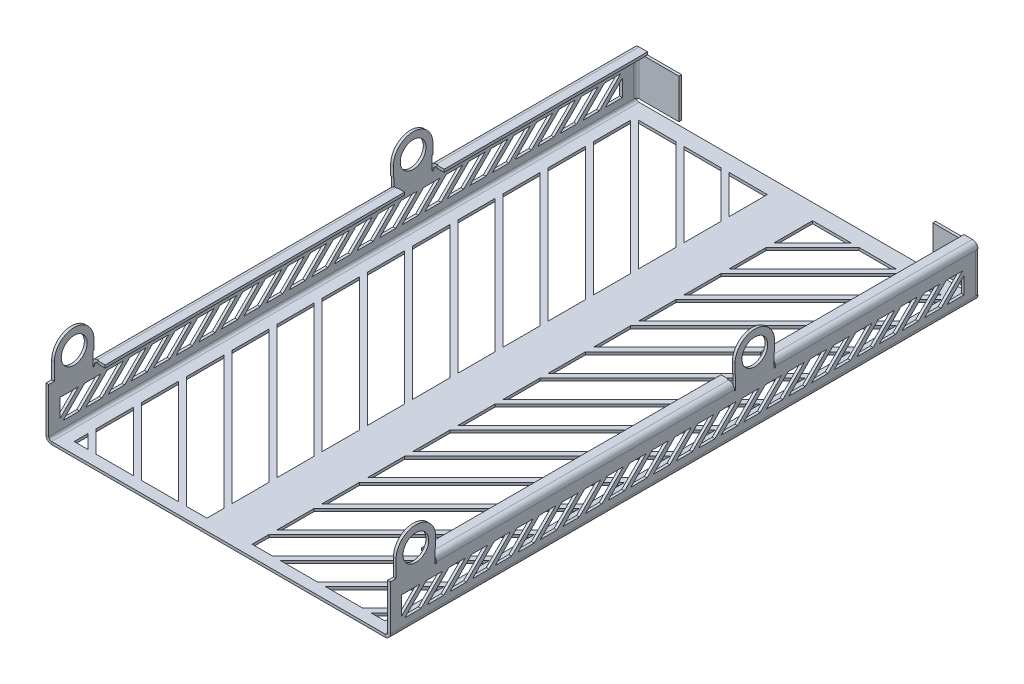
from build123d import *

# Parameters (mm, degrees)
EXTRUDE_THIN1_DEPTH          = 330.2
BOSS_EXTRUDE1_DEPTH          = 3.175
LPATTERN3_COUNT              = 2
LPATTERN3_PITCH              = 381
MIRROR5_COPY_1_DEPTH         = 3.175
CUT_EXTRUDE3_START           = -3.048
SKETCH28_W                   = 380.746
SKETCH28_H                   = 50.8
SKETCH28_H_2                 = 44.45
CUT_EXTRUDE3_DEPTH           = 3.048
F_1_1_8_CLEARANCE_HOLE1_D    = 28.97124
CONVERT_SOLID4_START         = -56.388
CONVERT_SOLID4_DEPTH         = 335.026
CONVERT_SOLID4_START_2       = -330.2
CONVERT_SOLID4_2_DEPTH       = 227.838
CONVERT_SOLID4_START_3       = -102.362
CONVERT_SOLID4_3_DEPTH       = 432.562
CONVERT_SOLID4_4_DEPTH       = 660.4
CONVERT_SOLID4_START_4       = -57.912
CONVERT_SOLID4_5_DEPTH       = 338.074
CONVERT_SOLID4_6_DEPTH       = 229.362
CONVERT_SOLID4_7_DEPTH       = 1.524
CONVERT_SOLID4_8_DEPTH       = 1.524
CONVERT_SOLID4_START_5       = 278.638
CONVERT_SOLID4_9_DEPTH       = 1.524
CONVERT_SOLID4_START_6       = 280.162
CONVERT_SOLID4_10_DEPTH      = 50.038
CONVERT_SOLID4_START_7       = -100.838
CONVERT_SOLID4_11_DEPTH      = 42.926
CONVERT_SOLID4_START_8       = -190.5
CONVERT_SOLID4_12_OUTLINE_R  = 14.48562
CONVERT_SOLID4_12_DEPTH      = 381
CONVERT_SOLID4_START_9       = -193.548
CONVERT_SOLID4_13_DEPTH      = 0.3088005
CONVERT_SOLID4_START_10      = 193.2391995
CONVERT_SOLID4_14_DEPTH      = 0.3088005
CONVERT_SOLID4_START_11      = -193.2391995
CONVERT_SOLID4_15_OUTLINE_W  = 10.795
CONVERT_SOLID4_15_OUTLINE_H  = 0.762
CONVERT_SOLID4_15_DEPTH      = 386.478399
CONVERT_SOLID4_16_OUTLINE_W  = 3.048
CONVERT_SOLID4_16_OUTLINE_H  = 0.762
CONVERT_SOLID4_16_DEPTH      = 7.4381995
CONVERT_SOLID4_START_12      = 185.801
CONVERT_SOLID4_17_OUTLINE_W  = 3.048
CONVERT_SOLID4_17_OUTLINE_H  = 0.762
CONVERT_SOLID4_17_DEPTH      = 7.4381995
EDGE_FLANGE1_STRIP_W         = 21.717
EDGE_FLANGE1_STRIP_H         = 3.048
EDGE_FLANGE1_STRIP_CUT_DEPTH = 44.45
EDGE_FLANGE1_DEPTH           = 44.45
VENT1_START                  = -3.048
VENT1_DEPTH                  = 3.048
VENT2_START                  = 190.5
VENT2_DEPTH                  = 3.048


# Read off the part's stored shape, not the designer's step: Convert-Solid4, Vent1, Vent2
# Sheet-metal steps are written as plain solids
with BuildPart() as part:
    # Sketch13 → Extrude-Thin1 (new, symmetric)
    with BuildSketch(Plane.XY):
        Polygon((-177.8, 50.8), (-190.5, 50.8), (-190.5, 0), (190.5, 0), (190.5, 50.8), (177.8, 50.8), (177.8, 53.848), (193.548, 53.848), (193.548, -3.048), (-193.548, -3.048), (-193.548, 53.848), (-177.8, 53.848), align=None)
    extrude(amount=EXTRUDE_THIN1_DEPTH, both=True)

    # Sketch18 → Boss-Extrude1 (add)
    with BuildSketch(Plane.ZY.offset(193.548)):
        with BuildLine():
            Line((279.4, 53.848), (323.85, 53.848))
            Line((323.85, 53.848), (323.85, 72.898))
            ThreePointArc((323.85, 72.898), (301.625, 95.123), (279.4, 72.898))
            Line((279.4, 72.898), (279.4, 53.848))
        make_face()
    boss_extrude1 = extrude(amount=-BOSS_EXTRUDE1_DEPTH)

    # LPattern3: Boss-Extrude1 ×2
    with Locations(*[(0, 0, -i * LPATTERN3_PITCH) for i in range(1, LPATTERN3_COUNT)]):
        add(boss_extrude1)

    # Mirror5: Boss-Extrude1 across plane
    add(boss_extrude1.mirror(Plane(origin=(0, 0, 0), x_dir=(0, 0, 1), z_dir=(1, 0, 0))))

    # Mirror5 copy 1 sketch → Mirror5 copy 1 (add)
    with BuildSketch(Plane(origin=(193.548, 0, -381), x_dir=(0, 0, 1), z_dir=(1, 0, 0))):
        with BuildLine():
            Line((279.4, -53.848), (323.85, -53.848))
            Line((323.85, -53.848), (323.85, -72.898))
            ThreePointArc((323.85, -72.898), (301.625, -95.123), (279.4, -72.898))
            Line((279.4, -72.898), (279.4, -53.848))
        make_face()
    extrude(amount=-MIRROR5_COPY_1_DEPTH)

    # Sketch28 → Cut-Extrude3 (cut)
    with BuildSketch(Plane(origin=(0, 53.848, 0), x_dir=(1, 0, 0), z_dir=(0, 1, 0)).offset(CUT_EXTRUDE3_START)):
        with Locations((0, -304.8)):
            Rectangle(SKETCH28_W, SKETCH28_H)
        with Locations((0, 79.375)):
            Rectangle(SKETCH28_W, SKETCH28_H_2)
    extrude(amount=CUT_EXTRUDE3_DEPTH, mode=Mode.SUBTRACT)

    # 1-1/8 Clearance Hole1 (through all)
    with Locations(Plane.ZY.offset(193.548)):
        with Locations((301.625, 72.898), (-79.375, 72.898)):
            Hole(F_1_1_8_CLEARANCE_HOLE1_D / 2)

    # Convert-Solid4 outline → Convert-Solid4 (add)
    with BuildSketch(Plane.XY.offset(CONVERT_SOLID4_START)):
        with BuildLine():
            ThreePointArc((187.325, 50.8), (189.57006403, 49.87006403), (190.5, 47.625))
            Line((190.5, 47.625), (190.5, 50.8))
            Line((190.5, 50.8), (187.325, 50.8))
        make_face()
        with BuildLine():
            Line((190.5, 0), (190.5, 3.175))
            ThreePointArc((190.5, 3.175), (189.57006403, 0.92993597), (187.325, 0))
            Line((187.325, 0), (190.5, 0))
        make_face()
        with BuildLine():
            Line((-190.5, 0), (-187.325, 0))
            ThreePointArc((-187.325, 0), (-189.57006403, 0.92993597), (-190.5, 3.175))
            Line((-190.5, 3.175), (-190.5, 0))
        make_face()
        with BuildLine():
            Line((-190.5, 50.8), (-190.5, 47.625))
            ThreePointArc((-190.5, 47.625), (-189.57006403, 49.87006403), (-187.325, 50.8))
            Line((-187.325, 50.8), (-190.5, 50.8))
        make_face()
    extrude(amount=CONVERT_SOLID4_DEPTH)

    # Convert-Solid4 2 outline → Convert-Solid4 2 (add)
    with BuildSketch(Plane.XY.offset(CONVERT_SOLID4_START_2)):
        with BuildLine():
            ThreePointArc((187.325, 50.8), (189.57006403, 49.87006403), (190.5, 47.625))
            Line((190.5, 47.625), (190.5, 50.8))
            Line((190.5, 50.8), (187.325, 50.8))
        make_face()
        with BuildLine():
            Line((190.5, 0), (190.5, 3.175))
            ThreePointArc((190.5, 3.175), (189.57006403, 0.92993597), (187.325, 0))
            Line((187.325, 0), (190.5, 0))
        make_face()
        with BuildLine():
            Line((-190.5, 0), (-187.325, 0))
            ThreePointArc((-187.325, 0), (-189.57006403, 0.92993597), (-190.5, 3.175))
            Line((-190.5, 3.175), (-190.5, 0))
        make_face()
        with BuildLine():
            Line((-190.5, 50.8), (-190.5, 47.625))
            ThreePointArc((-190.5, 47.625), (-189.57006403, 49.87006403), (-187.325, 50.8))
            Line((-187.325, 50.8), (-190.5, 50.8))
        make_face()
    extrude(amount=CONVERT_SOLID4_2_DEPTH)

    # Convert-Solid4 3 outline → Convert-Solid4 3 (add)
    with BuildSketch(Plane.XY.offset(CONVERT_SOLID4_START_3)):
        with BuildLine():
            Line((190.5, 0), (190.5, 3.175))
            ThreePointArc((190.5, 3.175), (189.57006403, 0.92993597), (187.325, 0))
            Line((187.325, 0), (190.5, 0))
        make_face()
        with BuildLine():
            Line((-190.5, 0), (-187.325, 0))
            ThreePointArc((-187.325, 0), (-189.57006403, 0.92993597), (-190.5, 3.175))
            Line((-190.5, 3.175), (-190.5, 0))
        make_face()
    extrude(amount=CONVERT_SOLID4_3_DEPTH)

    # Convert-Solid4 4 outline → Convert-Solid4 4 (cut)
    with BuildSketch(Plane.XY.offset(CONVERT_SOLID4_START_2)):
        with BuildLine():
            Line((193.548, -3.048), (193.548, 3.175))
            ThreePointArc((193.548, 3.175), (191.725325499, -1.225325499), (187.325, -3.048))
            Line((187.325, -3.048), (193.548, -3.048))
        make_face()
        with BuildLine():
            Line((190.5, 52.977112106), (190.5, 53.848))
            Line((190.5, 53.848), (187.325, 53.848))
            ThreePointArc((187.325, 53.848), (188.9711372, 53.626329962), (190.5, 52.977112106))
        make_face()
        with BuildLine():
            Line((-193.548, -3.048), (-187.325, -3.048))
            ThreePointArc((-187.325, -3.048), (-191.725325499, -1.225325499), (-193.548, 3.175))
            Line((-193.548, 3.175), (-193.548, -3.048))
        make_face()
        with BuildLine():
            Line((-190.5, 53.848), (-190.5, 52.977112106))
            ThreePointArc((-190.5, 52.977112106), (-188.9711372, 53.626329962), (-187.325, 53.848))
            Line((-187.325, 53.848), (-190.5, 53.848))
        make_face()
    extrude(amount=CONVERT_SOLID4_4_DEPTH, mode=Mode.SUBTRACT)

    # Convert-Solid4 5 outline → Convert-Solid4 5 (cut)
    with BuildSketch(Plane.XY.offset(CONVERT_SOLID4_START_4)):
        with BuildLine():
            ThreePointArc((190.5, 52.977112106), (192.732575889, 50.704586336), (193.548, 47.625))
            Line((193.548, 47.625), (193.548, 61.595))
            Line((193.548, 61.595), (190.5, 61.595))
            Line((190.5, 61.595), (190.5, 52.977112106))
        make_face()
        with BuildLine():
            ThreePointArc((-193.548, 47.625), (-192.732575889, 50.704586336), (-190.5, 52.977112106))
            Line((-190.5, 52.977112106), (-190.5, 61.595))
            Line((-190.5, 61.595), (-193.548, 61.595))
            Line((-193.548, 61.595), (-193.548, 47.625))
        make_face()
    extrude(amount=CONVERT_SOLID4_5_DEPTH, mode=Mode.SUBTRACT)

    # Convert-Solid4 6 outline → Convert-Solid4 6 (cut)
    with BuildSketch(Plane.XY.offset(CONVERT_SOLID4_START_2)):
        with BuildLine():
            ThreePointArc((190.5, 52.977112106), (192.732575889, 50.704586336), (193.548, 47.625))
            Line((193.548, 47.625), (193.548, 61.595))
            Line((193.548, 61.595), (190.5, 61.595))
            Line((190.5, 61.595), (190.5, 52.977112106))
        make_face()
        with BuildLine():
            ThreePointArc((-193.548, 47.625), (-192.732575889, 50.704586336), (-190.5, 52.977112106))
            Line((-190.5, 52.977112106), (-190.5, 61.595))
            Line((-190.5, 61.595), (-193.548, 61.595))
            Line((-193.548, 61.595), (-193.548, 47.625))
        make_face()
    extrude(amount=CONVERT_SOLID4_6_DEPTH, mode=Mode.SUBTRACT)

    # Convert-Solid4 7 outline → Convert-Solid4 7 (cut)
    with BuildSketch(Plane.XY.offset(CONVERT_SOLID4_START_3)):
        with BuildLine():
            Line((190.5, 46.101), (193.548, 46.101))
            Line((193.548, 46.101), (193.548, 47.625))
            ThreePointArc((193.548, 47.625), (191.725325499, 52.025325499), (187.325, 53.848))
            Line((187.325, 53.848), (185.801, 53.848))
            Line((185.801, 53.848), (185.801, 50.8))
            Line((185.801, 50.8), (190.5, 50.8))
            Line((190.5, 50.8), (190.5, 46.101))
        make_face()
        with BuildLine():
            Line((-193.548, 47.625), (-193.548, 46.101))
            Line((-193.548, 46.101), (-190.5, 46.101))
            Line((-190.5, 46.101), (-190.5, 50.8))
            Line((-190.5, 50.8), (-185.801, 50.8))
            Line((-185.801, 50.8), (-185.801, 53.848))
            Line((-185.801, 53.848), (-187.325, 53.848))
            ThreePointArc((-187.325, 53.848), (-191.725325499, 52.025325499), (-193.548, 47.625))
        make_face()
    extrude(amount=CONVERT_SOLID4_7_DEPTH, mode=Mode.SUBTRACT)

    # Convert-Solid4 8 outline → Convert-Solid4 8 (cut)
    with BuildSketch(Plane.XY.offset(CONVERT_SOLID4_START_4)):
        with BuildLine():
            Line((190.5, 46.101), (193.548, 46.101))
            Line((193.548, 46.101), (193.548, 47.625))
            ThreePointArc((193.548, 47.625), (191.725325499, 52.025325499), (187.325, 53.848))
            Line((187.325, 53.848), (185.801, 53.848))
            Line((185.801, 53.848), (185.801, 50.8))
            Line((185.801, 50.8), (190.5, 50.8))
            Line((190.5, 50.8), (190.5, 46.101))
        make_face()
        with BuildLine():
            Line((-193.548, 47.625), (-193.548, 46.101))
            Line((-193.548, 46.101), (-190.5, 46.101))
            Line((-190.5, 46.101), (-190.5, 50.8))
            Line((-190.5, 50.8), (-185.801, 50.8))
            Line((-185.801, 50.8), (-185.801, 53.848))
            Line((-185.801, 53.848), (-187.325, 53.848))
            ThreePointArc((-187.325, 53.848), (-191.725325499, 52.025325499), (-193.548, 47.625))
        make_face()
    extrude(amount=CONVERT_SOLID4_8_DEPTH, mode=Mode.SUBTRACT)

    # Convert-Solid4 9 outline → Convert-Solid4 9 (cut)
    with BuildSketch(Plane.XY.offset(CONVERT_SOLID4_START_5)):
        with BuildLine():
            Line((190.5, 46.101), (193.548, 46.101))
            Line((193.548, 46.101), (193.548, 47.625))
            ThreePointArc((193.548, 47.625), (191.725325499, 52.025325499), (187.325, 53.848))
            Line((187.325, 53.848), (185.801, 53.848))
            Line((185.801, 53.848), (185.801, 50.8))
            Line((185.801, 50.8), (190.5, 50.8))
            Line((190.5, 50.8), (190.5, 46.101))
        make_face()
        with BuildLine():
            Line((-193.548, 47.625), (-193.548, 46.101))
            Line((-193.548, 46.101), (-190.5, 46.101))
            Line((-190.5, 46.101), (-190.5, 50.8))
            Line((-190.5, 50.8), (-185.801, 50.8))
            Line((-185.801, 50.8), (-185.801, 53.848))
            Line((-185.801, 53.848), (-187.325, 53.848))
            ThreePointArc((-187.325, 53.848), (-191.725325499, 52.025325499), (-193.548, 47.625))
        make_face()
    extrude(amount=CONVERT_SOLID4_9_DEPTH, mode=Mode.SUBTRACT)

    # Convert-Solid4 10 outline → Convert-Solid4 10 (cut)
    with BuildSketch(Plane.XY.offset(CONVERT_SOLID4_START_6)):
        with BuildLine():
            Line((190.5, 50.8), (190.5, 52.977112106))
            ThreePointArc((190.5, 52.977112106), (190.436716019, 53.014151363), (190.373, 53.050442378))
            Line((190.373, 53.050442378), (190.373, 50.8))
            Line((190.373, 50.8), (190.5, 50.8))
        make_face()
        with BuildLine():
            ThreePointArc((-190.373, 53.050442378), (-190.436716019, 53.014151363), (-190.5, 52.977112106))
            Line((-190.5, 52.977112106), (-190.5, 50.8))
            Line((-190.5, 50.8), (-190.373, 50.8))
            Line((-190.373, 50.8), (-190.373, 53.050442378))
        make_face()
    extrude(amount=CONVERT_SOLID4_10_DEPTH, mode=Mode.SUBTRACT)

    # Convert-Solid4 11 outline → Convert-Solid4 11 (cut)
    with BuildSketch(Plane.XY.offset(CONVERT_SOLID4_START_7)):
        with BuildLine():
            Line((190.5, 50.8), (190.5, 52.977112106))
            ThreePointArc((190.5, 52.977112106), (190.436716019, 53.014151363), (190.373, 53.050442378))
            Line((190.373, 53.050442378), (190.373, 50.8))
            Line((190.373, 50.8), (190.5, 50.8))
        make_face()
        with BuildLine():
            ThreePointArc((-190.373, 53.050442378), (-190.436716019, 53.014151363), (-190.5, 52.977112106))
            Line((-190.5, 52.977112106), (-190.5, 50.8))
            Line((-190.5, 50.8), (-190.373, 50.8))
            Line((-190.373, 50.8), (-190.373, 53.050442378))
        make_face()
    extrude(amount=CONVERT_SOLID4_11_DEPTH, mode=Mode.SUBTRACT)

    # Convert-Solid4 12 outline → Convert-Solid4 12 (cut)
    # profile 1 of 2: a face of its own
    with BuildSketch(Plane.YZ.offset(CONVERT_SOLID4_START_8)):
        with BuildLine():
            Line((50.8, 279.4), (72.898, 279.4))
            ThreePointArc((72.898, 279.4), (95.123, 301.625), (72.898, 323.85))
            Line((72.898, 323.85), (53.848, 323.85))
            Line((53.848, 323.85), (53.848, 330.2))
            Line((53.848, 330.2), (50.8, 330.2))
            Line((50.8, 330.2), (50.8, 279.4))
        make_face()
        with Locations((72.898, 301.625)):
            Circle(CONVERT_SOLID4_12_OUTLINE_R, mode=Mode.SUBTRACT)
    # profile 2 of 2: a face of its own
    with BuildSketch(Plane.YZ.offset(CONVERT_SOLID4_START_8)):
        with BuildLine():
            Line((50.8, -57.15), (50.8, -101.6))
            Line((50.8, -101.6), (72.898, -101.6))
            ThreePointArc((72.898, -101.6), (95.123, -79.375), (72.898, -57.15))
            Line((72.898, -57.15), (50.8, -57.15))
        make_face()
        with Locations((72.898, -79.375)):
            Circle(CONVERT_SOLID4_12_OUTLINE_R, mode=Mode.SUBTRACT)
    extrude(amount=CONVERT_SOLID4_12_DEPTH, mode=Mode.SUBTRACT)

    # Convert-Solid4 13 outline → Convert-Solid4 13 (cut)
    with BuildSketch(Plane.YZ.offset(CONVERT_SOLID4_START_9)):
        Polygon((50.8, 280.162), (50.8, -57.912), (61.595, -57.912), (61.595, -57.15), (53.848, -57.15), (53.848, 279.4), (61.595, 279.4), (61.595, 280.162), align=None)
        Polygon((61.595, -100.838), (50.8, -100.838), (50.8, -330.2), (53.848, -330.2), (53.848, -101.6), (61.595, -101.6), align=None)
    extrude(amount=CONVERT_SOLID4_13_DEPTH, mode=Mode.SUBTRACT)

    # Convert-Solid4 14 outline → Convert-Solid4 14 (cut)
    with BuildSketch(Plane.YZ.offset(CONVERT_SOLID4_START_10)):
        Polygon((50.8, 280.162), (50.8, -57.912), (61.595, -57.912), (61.595, -57.15), (53.848, -57.15), (53.848, 279.4), (61.595, 279.4), (61.595, 280.162), align=None)
        Polygon((61.595, -100.838), (50.8, -100.838), (50.8, -330.2), (53.848, -330.2), (53.848, -101.6), (61.595, -101.6), align=None)
    extrude(amount=CONVERT_SOLID4_14_DEPTH, mode=Mode.SUBTRACT)

    # Convert-Solid4 15 outline → Convert-Solid4 15 (cut)
    with BuildSketch(Plane.YZ.offset(CONVERT_SOLID4_START_11)):
        with Locations((56.1975, 279.781)):
            Rectangle(CONVERT_SOLID4_15_OUTLINE_W, CONVERT_SOLID4_15_OUTLINE_H)
        with Locations((56.1975, -57.531)):
            Rectangle(CONVERT_SOLID4_15_OUTLINE_W, CONVERT_SOLID4_15_OUTLINE_H)
        with Locations((56.1975, -101.219)):
            Rectangle(CONVERT_SOLID4_15_OUTLINE_W, CONVERT_SOLID4_15_OUTLINE_H)
    extrude(amount=CONVERT_SOLID4_15_DEPTH, mode=Mode.SUBTRACT)

    # Convert-Solid4 16 outline → Convert-Solid4 16 (cut)
    with BuildSketch(Plane.YZ.offset(CONVERT_SOLID4_START_11)):
        with Locations((52.324, 279.019)):
            Rectangle(CONVERT_SOLID4_16_OUTLINE_W, CONVERT_SOLID4_16_OUTLINE_H)
        with Locations((52.324, -56.769)):
            Rectangle(CONVERT_SOLID4_16_OUTLINE_W, CONVERT_SOLID4_16_OUTLINE_H)
        with Locations((52.324, -101.981)):
            Rectangle(CONVERT_SOLID4_16_OUTLINE_W, CONVERT_SOLID4_16_OUTLINE_H)
    extrude(amount=CONVERT_SOLID4_16_DEPTH, mode=Mode.SUBTRACT)

    # Convert-Solid4 17 outline → Convert-Solid4 17 (cut)
    with BuildSketch(Plane.YZ.offset(CONVERT_SOLID4_START_12)):
        with Locations((52.324, 279.019)):
            Rectangle(CONVERT_SOLID4_17_OUTLINE_W, CONVERT_SOLID4_17_OUTLINE_H)
        with Locations((52.324, -56.769)):
            Rectangle(CONVERT_SOLID4_17_OUTLINE_W, CONVERT_SOLID4_17_OUTLINE_H)
        with Locations((52.324, -101.981)):
            Rectangle(CONVERT_SOLID4_17_OUTLINE_W, CONVERT_SOLID4_17_OUTLINE_H)
    extrude(amount=CONVERT_SOLID4_17_DEPTH, mode=Mode.SUBTRACT)

    # Edge-Flange1 strip (across the edge) → Edge-Flange1 strip cut (cut)
    with BuildSketch(Plane(origin=(-190.5, 3.175, -333.375), x_dir=(0, 0, 1), z_dir=(0, 1, 0))):
        with Locations((-4.6355, -1.524)):
            Rectangle(EDGE_FLANGE1_STRIP_W, EDGE_FLANGE1_STRIP_H)
    edge_flange1_strip_cut = extrude(amount=EDGE_FLANGE1_STRIP_CUT_DEPTH, mode=Mode.SUBTRACT)

    # Edge-Flange1 section (across the edge) → Edge-Flange1 (add)
    with BuildSketch(Plane(origin=(-190.5, 3.175, -333.375), x_dir=(0, 0, 1), z_dir=(0, 1, 0))):
        with BuildLine():
            Line((0, 3.175), (0, 47.752))
            Line((0, 47.752), (3.048, 47.752))
            Line((3.048, 47.752), (3.048, 3.175))
            ThreePointArc((3.048, 3.175), (3.97793597, 0.92993597), (6.223, 0))
            Line((6.223, 0), (6.223, -3.048))
            ThreePointArc((6.223, -3.048), (1.822674501, -1.225325499), (0, 3.175))
        make_face()
    edge_flange1 = extrude(amount=EDGE_FLANGE1_DEPTH)

    # Mirror6: Edge-Flange1 strip cut, Edge-Flange1 across plane
    add(edge_flange1_strip_cut.mirror(Plane(origin=(0, 0, 0), x_dir=(0, 0, 1), z_dir=(1, 0, 0))), mode=Mode.SUBTRACT)
    add(edge_flange1.mirror(Plane(origin=(0, 0, 0), x_dir=(0, 0, 1), z_dir=(1, 0, 0))))

    # Vent1 outline → Vent1 (cut)
    with BuildSketch(Plane(origin=(0, 0, 0), x_dir=(1, 0, 0), z_dir=(0, 1, 0)).offset(VENT1_START)):
        Polygon((68.534871939, 312.421588084), (25.4, 312.421588084), (25.4, 269.286716144), align=None)
        Polygon((77.515128061, 312.421588084), (25.4, 260.306460023), (25.4, 218.486716144), (119.334871939, 312.421588084), align=None)
        Polygon((128.315128061, 312.421588084), (25.4, 209.506460023), (25.4, 167.686716144), (170.134871939, 312.421588084), align=None)
        Polygon((174.625, 307.931460023), (25.4, 158.706460023), (25.4, 116.886716144), (174.625, 266.111716144), align=None)
        Polygon((174.625, 257.131460023), (25.4, 107.906460023), (25.4, 66.086716144), (174.625, 215.311716144), align=None)
        Polygon((174.625, 206.331460023), (25.4, 57.106460023), (25.4, 15.286716144), (174.625, 164.511716144), align=None)
        Polygon((174.625, 155.531460023), (25.4, 6.306460023), (25.4, -35.513283856), (174.625, 113.711716144), align=None)
        Polygon((174.625, 104.731460023), (25.4, -44.493539977), (25.4, -86.313283856), (174.625, 62.911716144), align=None)
        Polygon((174.625, 53.931460023), (25.4, -95.293539977), (25.4, -137.113283856), (174.625, 12.111716144), align=None)
        Polygon((174.625, 3.131460023), (25.4, -146.093539977), (25.4, -187.913283856), (174.625, -38.688283856), align=None)
        Polygon((174.625, -47.668539977), (25.4, -196.893539977), (25.4, -238.713283856), (174.625, -89.488283856), align=None)
        Polygon((174.625, -98.468539977), (25.4, -247.693539977), (25.4, -289.513283856), (174.625, -140.288283856), align=None)
        Polygon((174.625, -149.268539977), (25.4, -298.493539977), (25.4, -317.5), (48.213283856, -317.5), (174.625, -191.088283856), align=None)
        Polygon((99.013283856, -317.5), (174.625, -241.888283856), (174.625, -200.068539977), (57.193539977, -317.5), align=None)
        Polygon((149.813283856, -317.5), (174.625, -292.688283856), (174.625, -250.868539977), (107.993539977, -317.5), align=None)
        Polygon((158.793539977, -317.5), (174.625, -317.5), (174.625, -301.668539977), align=None)
    vent1 = extrude(amount=VENT1_DEPTH, mode=Mode.SUBTRACT)

    # Mirror7: Vent1 across plane
    add(vent1.mirror(Plane(origin=(0, 0, 0), x_dir=(0, 0, 1), z_dir=(1, 0, 0))), mode=Mode.SUBTRACT)

    # Vent2 outline → Vent2 (cut)
    with BuildSketch(Plane.YZ.offset(VENT2_START)):
        Polygon((34.925, 296.962102448), (34.925, 317.5), (14.387102448, 317.5), align=None)
        Polygon((34.925, 271.562102448), (34.925, 289.777897552), (10.795, 313.907897552), (10.795, 295.692102448), align=None)
        Polygon((34.925, 246.162102448), (34.925, 264.377897552), (10.795, 288.507897552), (10.795, 270.292102448), align=None)
        Polygon((34.925, 220.762102448), (34.925, 238.977897552), (10.795, 263.107897552), (10.795, 244.892102448), align=None)
        Polygon((34.925, 195.362102448), (34.925, 213.577897552), (10.795, 237.707897552), (10.795, 219.492102448), align=None)
        Polygon((34.925, 169.962102448), (34.925, 188.177897552), (10.795, 212.307897552), (10.795, 194.092102448), align=None)
        Polygon((34.925, 144.562102448), (34.925, 162.777897552), (10.795, 186.907897552), (10.795, 168.692102448), align=None)
        Polygon((34.925, 119.162102448), (34.925, 137.377897552), (10.795, 161.507897552), (10.795, 143.292102448), align=None)
        Polygon((34.925, 93.762102448), (34.925, 111.977897552), (10.795, 136.107897552), (10.795, 117.892102448), align=None)
        Polygon((34.925, 68.362102448), (34.925, 86.577897552), (10.795, 110.707897552), (10.795, 92.492102448), align=None)
        Polygon((34.925, 42.962102448), (34.925, 61.177897552), (10.795, 85.307897552), (10.795, 67.092102448), align=None)
        Polygon((34.925, 17.562102448), (34.925, 35.777897552), (10.795, 59.907897552), (10.795, 41.692102448), align=None)
        Polygon((34.925, -7.837897552), (34.925, 10.377897552), (10.795, 34.507897552), (10.795, 16.292102448), align=None)
        Polygon((34.925, -33.237897552), (34.925, -15.022102448), (10.795, 9.107897552), (10.795, -9.107897552), align=None)
        Polygon((34.925, -58.637897552), (34.925, -40.422102448), (10.795, -16.292102448), (10.795, -34.507897552), align=None)
        Polygon((34.925, -84.037897552), (34.925, -65.822102448), (10.795, -41.692102448), (10.795, -59.907897552), align=None)
        Polygon((34.925, -109.437897552), (34.925, -91.222102448), (10.795, -67.092102448), (10.795, -85.307897552), align=None)
        Polygon((34.925, -134.837897552), (34.925, -116.622102448), (10.795, -92.492102448), (10.795, -110.707897552), align=None)
        Polygon((34.925, -160.237897552), (34.925, -142.022102448), (10.795, -117.892102448), (10.795, -136.107897552), align=None)
        Polygon((34.925, -185.637897552), (34.925, -167.422102448), (10.795, -143.292102448), (10.795, -161.507897552), align=None)
        Polygon((34.925, -211.037897552), (34.925, -192.822102448), (10.795, -168.692102448), (10.795, -186.907897552), align=None)
        Polygon((34.925, -236.437897552), (34.925, -218.222102448), (10.795, -194.092102448), (10.795, -212.307897552), align=None)
        Polygon((34.925, -261.837897552), (34.925, -243.622102448), (10.795, -219.492102448), (10.795, -237.707897552), align=None)
        Polygon((34.925, -287.237897552), (34.925, -269.022102448), (10.795, -244.892102448), (10.795, -263.107897552), align=None)
        Polygon((34.925, -312.637897552), (34.925, -294.422102448), (10.795, -270.292102448), (10.795, -288.507897552), align=None)
        Polygon((10.795, -295.692102448), (10.795, -314.452), (29.554897552, -314.452), align=None)
    vent2 = extrude(amount=VENT2_DEPTH, mode=Mode.SUBTRACT)

    # Mirror8: Vent2 across plane
    add(vent2.mirror(Plane(origin=(0, 0, 0), x_dir=(0, 0, 1), z_dir=(1, 0, 0))), mode=Mode.SUBTRACT)


solid = part.part
